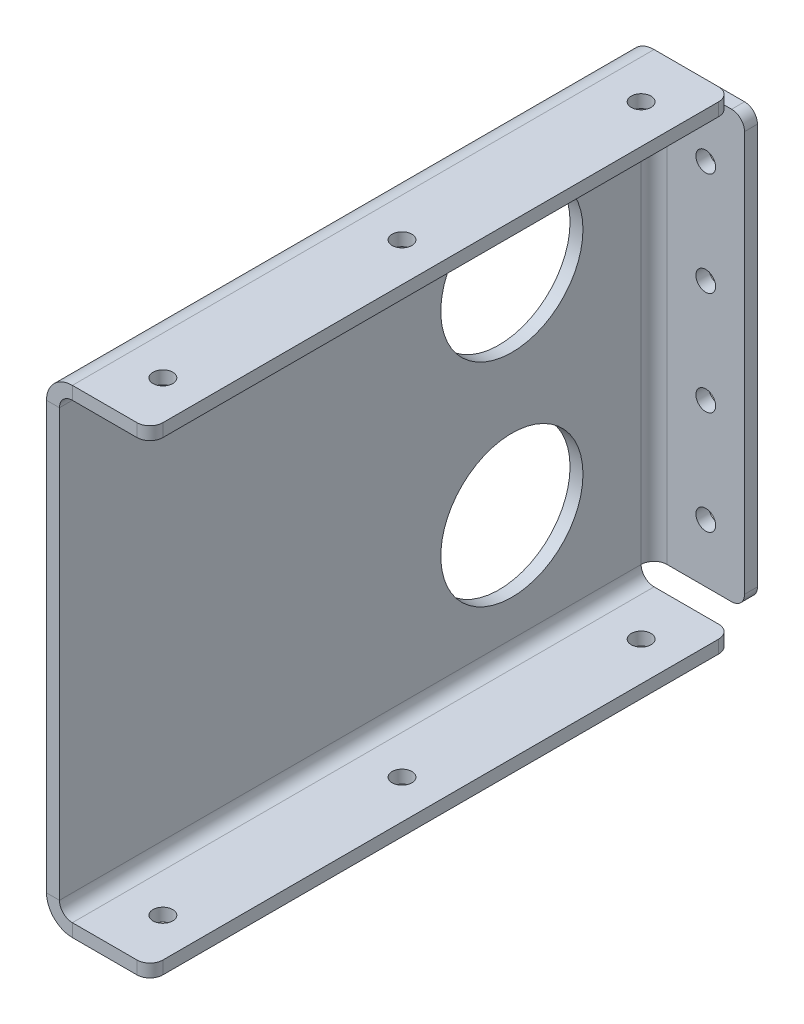
from build123d import *

# Parameters (mm, degrees)
BASE_FLANGE1_DEPTH = 142.875
EDGE_FLANGE1_DEPTH = 104.775
SKETCH9_R          = 17.4625
CUT_EXTRUDE1_DEPTH = 187.299736648
SKETCH10_R         = 2.4257
CUT_EXTRUDE2_DEPTH = 187.705118435
SKETCH11_R         = 2.4257
CUT_EXTRUDE3_DEPTH = 192.608027624
FILLET1_R          = 3.175


# Sheet-metal steps are written as plain solids
with BuildPart() as part:
    # Sketch1 → Base-Flange1 (new body)
    with BuildSketch(Plane.XY):
        with BuildLine():
            Line((25.4, 117.475), (6.35, 117.475))
            ThreePointArc((6.35, 117.475), (1.859871939, 115.615128061), (0, 111.125))
            Line((0, 111.125), (0, 6.35))
            ThreePointArc((0, 6.35), (1.859871939, 1.859871939), (6.35, 0))
            Line((6.35, 0), (25.4, 0))
            Line((25.4, 0), (25.4, 3.175))
            Line((25.4, 3.175), (6.35, 3.175))
            ThreePointArc((6.35, 3.175), (4.10493597, 4.10493597), (3.175, 6.35))
            Line((3.175, 6.35), (3.175, 111.125))
            ThreePointArc((3.175, 111.125), (4.10493597, 113.37006403), (6.35, 114.3))
            Line((6.35, 114.3), (25.4, 114.3))
            Line((25.4, 114.3), (25.4, 117.475))
        make_face()
    extrude(amount=BASE_FLANGE1_DEPTH)

    # Edge-Flange1 section (across the edge) → Edge-Flange1 (add)
    with BuildSketch(Plane(origin=(3.175, 6.35, -3.175), x_dir=(0, 0, 1), z_dir=(0, 1, 0))):
        with BuildLine():
            Line((-3.175, 3.175), (-3.175, 22.225))
            Line((-3.175, 22.225), (0, 22.225))
            Line((0, 22.225), (0, 3.175))
            ThreePointArc((0, 3.175), (0.92993597, 0.92993597), (3.175, 0))
            Line((3.175, 0), (3.175, -3.175))
            ThreePointArc((3.175, -3.175), (-1.315128061, -1.315128061), (-3.175, 3.175))
        make_face()
    extrude(amount=EDGE_FLANGE1_DEPTH)

    # Sketch9 → Cut-Extrude1 (cut, through all)
    with BuildSketch(Plane(origin=(3.175, 0, 0), x_dir=(0, 0, -1), z_dir=(1, 0, 0))):
        with Locations((-31.75, 84.7725)):
            Circle(SKETCH9_R)
        with Locations((-31.75, 32.7025)):
            Circle(SKETCH9_R)
    extrude(amount=-CUT_EXTRUDE1_DEPTH, mode=Mode.SUBTRACT)

    # Sketch10 → Cut-Extrude2 (cut, through all)
    with BuildSketch(Plane(origin=(0, 117.475, 0), x_dir=(1, 0, 0), z_dir=(0, 1, 0))):
        with Locations(Location((15.875, -71.4375, 0), (0, 0, 270))):
            Circle(SKETCH10_R)
        with Locations(Location((15.875, -130.175, 0), (0, 0, 270))):
            Circle(SKETCH10_R)
        with Locations(Location((15.875, -12.7, 0), (0, 0, 270))):
            Circle(SKETCH10_R)
    extrude(amount=-CUT_EXTRUDE2_DEPTH, mode=Mode.SUBTRACT)

    # Sketch11 → Cut-Extrude3 (cut, through all)
    with BuildSketch(Plane(origin=(0, 0, -6.35), x_dir=(-1, 0, 0), z_dir=(0, 0, -1))):
        with Locations((-15.875, 20.6375)):
            Circle(SKETCH11_R)
        with Locations((-15.875, 96.8375)):
            Circle(SKETCH11_R)
        with Locations((-15.875, 71.4375)):
            Circle(SKETCH11_R)
        with Locations((-15.875, 46.0375)):
            Circle(SKETCH11_R)
    extrude(amount=-CUT_EXTRUDE3_DEPTH, mode=Mode.SUBTRACT)

    # Fillet1
    fillet1_edges = [part.edges().sort_by_distance(p)[0] for p in [
        (25.4, 1.5875, 0),
        (25.4, 115.8875, 0),
        (25.4, 1.5875, 142.875),
        (25.4, 6.35, -4.7625),
        (25.4, 111.125, -4.7625),
        (25.4, 115.8875, 142.875),
    ]]
    fillet(fillet1_edges, radius=FILLET1_R)


solid = part.part
